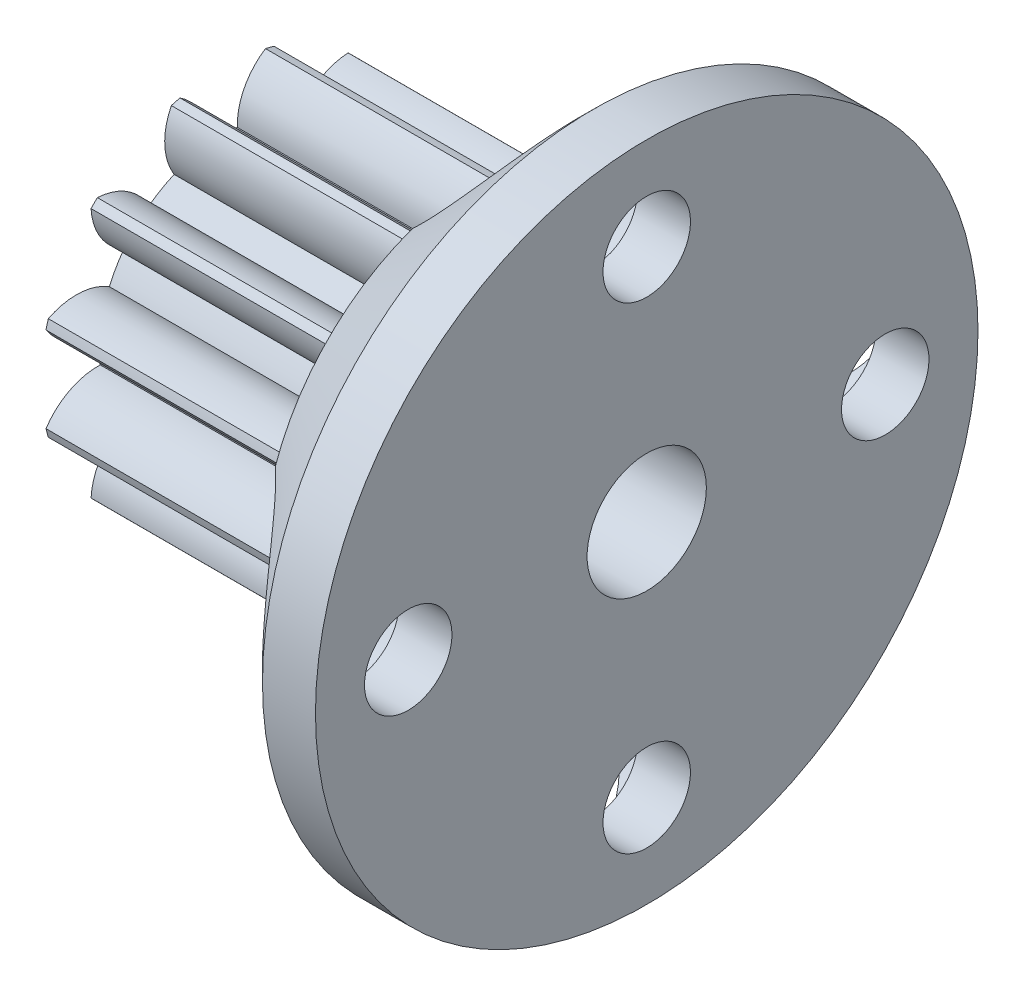
from build123d import *

# Parameters (mm, degrees)
BASPROSKE_W         = 10
BASPROSKE_H         = 6.86
TOOTHCUT_DEPTH      = 14.932666651
TEETHCUTS_COUNT     = 12
TEETHCUTS_ANGLE     = 330
BORSKE_R            = 1
BORE_DEPTH          = 50.0000508
SKETCH1_R           = 12.5
BOSS_EXTRUDE1_DEPTH = 6
SKETCH2_R           = 1.65
CUT_EXTRUDE1_DEPTH  = 21.310096012
SKETCH3_R           = 3
CUT_EXTRUDE2_DEPTH  = 4
CIRPATTERN1_COUNT   = 4
CHAMFER1_SIZE       = 4
SKETCH4_R           = 2.25
CUT_EXTRUDE3_DEPTH  = 6


with BuildPart() as part:
    # BasProSke → Base-Revolve (revolve)
    with BuildSketch(Plane(origin=(0, 0, 0), x_dir=(1, 0, 0), z_dir=(0, 1, 0)), mode=Mode.PRIVATE) as base_revolve_sk:
        with Locations((5, 3.43)):
            Rectangle(BASPROSKE_W, BASPROSKE_H)
    revolve(base_revolve_sk.sketch.rotate(Axis((-10, 0, 0), (1, 0, 0)), 180), axis=Axis((-10, 0, 0), (1, 0, 0)))

    # TooCutSke → ToothCut (cut, through all)
    with BuildSketch(Plane(origin=(0, 0, 0), x_dir=(0, 0, -1), z_dir=(1, 0, 0))):
        with BuildLine():
            ThreePointArc((0.552016647, 4.621146354), (0, 4.654), (-0.552016647, 4.621146354))
            ThreePointArc((-0.552016647, 4.621146354), (-0.822258441, 5.798784691), (-1.641510828, 6.686865885))
            ThreePointArc((-1.641510828, 6.686865885), (0, 6.8854), (1.641510828, 6.686865885))
            ThreePointArc((1.641510828, 6.686865885), (0.822258441, 5.798784691), (0.552016647, 4.621146354))
        make_face()
    toothcut = extrude(amount=TOOTHCUT_DEPTH, mode=Mode.SUBTRACT)

    # TeethCuts: ToothCut ×12 about axis
    teethcuts_axis = Axis((-10, 0, 0), (1, 0, 0))
    for i in range(1, TEETHCUTS_COUNT):
        add(toothcut.rotate(teethcuts_axis, i * TEETHCUTS_ANGLE / (TEETHCUTS_COUNT - 1)), mode=Mode.SUBTRACT)

    # BorSke → Bore (cut, symmetric)
    with BuildSketch(Plane(origin=(0, 0, 0), x_dir=(0, 0, -1), z_dir=(1, 0, 0))):
        with Locations(Location((0, 0, 0), (0, 0, 180))):
            Circle(BORSKE_R)
    extrude(amount=BORE_DEPTH, both=True, mode=Mode.SUBTRACT)

    # Sketch1 → Boss-Extrude1 (add)
    with BuildSketch(Plane(origin=(10, 0, 0), x_dir=(0, 0, -1), z_dir=(1, 0, 0))):
        Circle(SKETCH1_R)
    extrude(amount=BOSS_EXTRUDE1_DEPTH)

    # Sketch2 → Cut-Extrude1 (cut, through all)
    with BuildSketch(Plane.ZY.offset(-10)):
        with Locations((0, 9)):
            Circle(SKETCH2_R)
    cut_extrude1 = extrude(amount=-CUT_EXTRUDE1_DEPTH, mode=Mode.SUBTRACT)

    # Sketch3 → Cut-Extrude2 (cut)
    with BuildSketch(Plane.ZY.offset(-10)):
        with Locations((0, 9)):
            Circle(SKETCH3_R)
    cut_extrude2 = extrude(amount=-CUT_EXTRUDE2_DEPTH, mode=Mode.SUBTRACT)

    # CirPattern1: Cut-Extrude1, Cut-Extrude2 ×4 about axis
    cirpattern1_axis = Axis((0, 0, 0), (1, 0, 0))
    add([cut_extrude1.rotate(cirpattern1_axis, i * 360 / CIRPATTERN1_COUNT) for i in range(1, CIRPATTERN1_COUNT)], mode=Mode.SUBTRACT)
    add([cut_extrude2.rotate(cirpattern1_axis, i * 360 / CIRPATTERN1_COUNT) for i in range(1, CIRPATTERN1_COUNT)], mode=Mode.SUBTRACT)

    # Chamfer1
    # the kernel refuses this chamfer: 4 mm, written as the material it takes off along each edge
    with BuildSketch(Plane(origin=(10, 0, 0), x_dir=(0, 0, -1), z_dir=(0, -1, 0))) as chamfer1_piece_1:
        Polygon((12.5, CHAMFER1_SIZE), (12.5 - CHAMFER1_SIZE, 0), (12.5, 0), align=None)
    revolve(axis=Axis((10, 0, 0), (1, 0, 0)), mode=Mode.SUBTRACT)

    # Sketch4 → Cut-Extrude3 (cut)
    with BuildSketch(Plane(origin=(16, 0, 0), x_dir=(0, 0, -1), z_dir=(1, 0, 0))):
        Circle(SKETCH4_R)
    extrude(amount=-CUT_EXTRUDE3_DEPTH, mode=Mode.SUBTRACT)


solid = part.part
